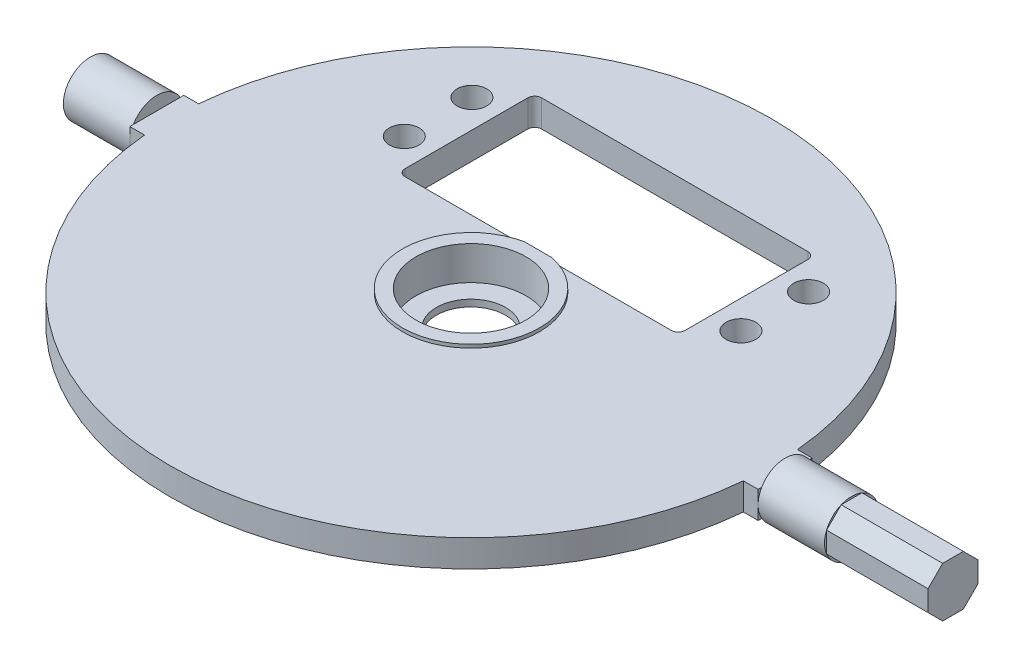
from build123d import *

# Parameters (mm, degrees)
SKETCH1_R           = 10.125
BOSS_EXTRUDE1_DEPTH = 2
SKETCH1_6_W         = 9.819656651
SKETCH1_6_H         = 4
SKETCH1_7_R         = 10.125
SKETCH1_7_R_2       = 8.125
BOSS_EXTRUDE2_DEPTH = 2.5
CAVITY1_START       = -2.5
CAVITY1_DEPTH       = 5
SKETCH3_R           = 2.2
CUT_EXTRUDE1_DEPTH  = 72.95885463
SKETCH4_W           = 1.5
SKETCH4_H           = 3.8
CUT_EXTRUDE2_DEPTH  = 20
BOSS_EXTRUDE3_DEPTH = 15
SKETCH6_R           = 10.125
SKETCH6_R_2         = 5.125
BOSS_EXTRUDE4_DEPTH = 1


# Read off the part's stored shape, not the designer's step: Cavity1
with BuildPart() as part:
    # Sketch1 → Boss-Extrude1 (new, symmetric)
    with BuildSketch(Plane(origin=(0, 0, 0), x_dir=(1, 0, 0), z_dir=(0, 1, 0))):
        with BuildLine():
            Line((-44.269656651, 4), (-46.45, 4))
            Line((-46.45, 4), (-46.45, -4))
            Line((-46.45, -4), (-44.269656651, -4))
            ThreePointArc((-44.269656651, -4), (0, -44.45), (44.269656651, -4))
            Line((44.269656651, -4), (46.45, -4))
            Line((46.45, -4), (46.45, 4))
            Line((46.45, 4), (44.269656651, 4))
            ThreePointArc((44.269656651, 4), (0, 44.45), (-44.269656651, 4))
        make_face()
        with Locations(Location((0, 0, 0), (0, 0, 270))):
            Circle(SKETCH1_R, mode=Mode.SUBTRACT)
    extrude(amount=BOSS_EXTRUDE1_DEPTH, both=True)

    # Sketch1<6> → Revolve1 (revolve)
    with BuildSketch(Plane(origin=(0, 0, 0), x_dir=(1, 0, 0), z_dir=(0, 1, 0))):
        with Locations((-51.359828326, -2)):
            Rectangle(SKETCH1_6_W, SKETCH1_6_H)
        with Locations((51.359828326, -2)):
            Rectangle(SKETCH1_6_W, SKETCH1_6_H)
    revolve(axis=Axis((-76.43543075, 0, 0), (1, 0, 0)))

    # Sketch1<7> → Boss-Extrude2 (add, symmetric)
    with BuildSketch(Plane(origin=(0, 0, 0), x_dir=(1, 0, 0), z_dir=(0, 1, 0))):
        with Locations(Location((0, 0, 0), (0, 0, 270))):
            Circle(SKETCH1_7_R)
        with Locations(Location((0, 0, 0), (0, 0, 270))):
            Circle(SKETCH1_7_R_2, mode=Mode.SUBTRACT)
    extrude(amount=BOSS_EXTRUDE2_DEPTH, both=True)

    # Cavity1 outline → Cavity1 (cut)
    with BuildSketch(Plane(origin=(0, 0, 0), x_dir=(1, 0, 0), z_dir=(0, 1, 0)).offset(CAVITY1_START)):
        with BuildLine():
            Line((20.706, 10.947), (20.706, 29.103))
            ThreePointArc((20.706, 29.103), (20.407248917, 29.824248917), (19.686, 30.123))
            Line((19.686, 30.123), (-19.686, 30.123))
            ThreePointArc((-19.686, 30.123), (-20.407248917, 29.824248917), (-20.706, 29.103))
            Line((-20.706, 29.103), (-20.706, 10.947))
            ThreePointArc((-20.706, 10.947), (-20.407248917, 10.225751083), (-19.686, 9.927))
            Line((-19.686, 9.927), (19.686, 9.927))
            ThreePointArc((19.686, 9.927), (20.407248917, 10.225751083), (20.706, 10.947))
        make_face()
    extrude(amount=CAVITY1_DEPTH, mode=Mode.SUBTRACT)

    # Sketch3 → Cut-Extrude1 (cut, through all)
    with BuildSketch(Plane(origin=(0, 2, 0), x_dir=(1, 0, 0), z_dir=(0, 1, 0))):
        with Locations(Location((-24.889613301, 25.025, 0), (0, 0, 270))):
            Circle(SKETCH3_R)
        with Locations(Location((-24.889613301, 15.025, 0), (0, 0, 270))):
            Circle(SKETCH3_R)
        with Locations(Location((24.889613301, 15.025, 0), (0, 0, 270))):
            Circle(SKETCH3_R)
        with Locations(Location((24.889613301, 25.025, 0), (0, 0, 270))):
            Circle(SKETCH3_R)
    extrude(amount=-CUT_EXTRUDE1_DEPTH, mode=Mode.SUBTRACT)

    # Sketch4 → Cut-Extrude2 (cut)
    with BuildSketch(Plane.ZY.offset(56.269656651)):
        with Locations((0, -2.1)):
            Rectangle(SKETCH4_W, SKETCH4_H)
    extrude(amount=-CUT_EXTRUDE2_DEPTH, mode=Mode.SUBTRACT)

    # Sketch6 → Boss-Extrude4 (add)
    with BuildSketch(Plane.XZ.offset(2.5)):
        with Locations(Location((0, 0, 0), (0, 0, 270))):
            Circle(SKETCH6_R)
        with Locations(Location((0, 0, 0), (0, 0, 270))):
            Circle(SKETCH6_R_2, mode=Mode.SUBTRACT)
    extrude(amount=BOSS_EXTRUDE4_DEPTH)


with BuildPart() as body_2:
    # Sketch5 → Boss-Extrude3 (new body)
    with BuildSketch(Plane(origin=(56.269656651, 0, 0), x_dir=(0, 0, -1), z_dir=(1, 0, 0))):
        Polygon((3.69551813, 1.530733729), (1.530733729, 3.69551813), (-1.530733729, 3.69551813), (-3.69551813, 1.530733729), (-3.69551813, -1.530733729), (-1.530733729, -3.69551813), (1.530733729, -3.69551813), (3.69551813, -1.530733729), align=None)
    extrude(amount=BOSS_EXTRUDE3_DEPTH)


solid = Compound([part.part, body_2.part])
